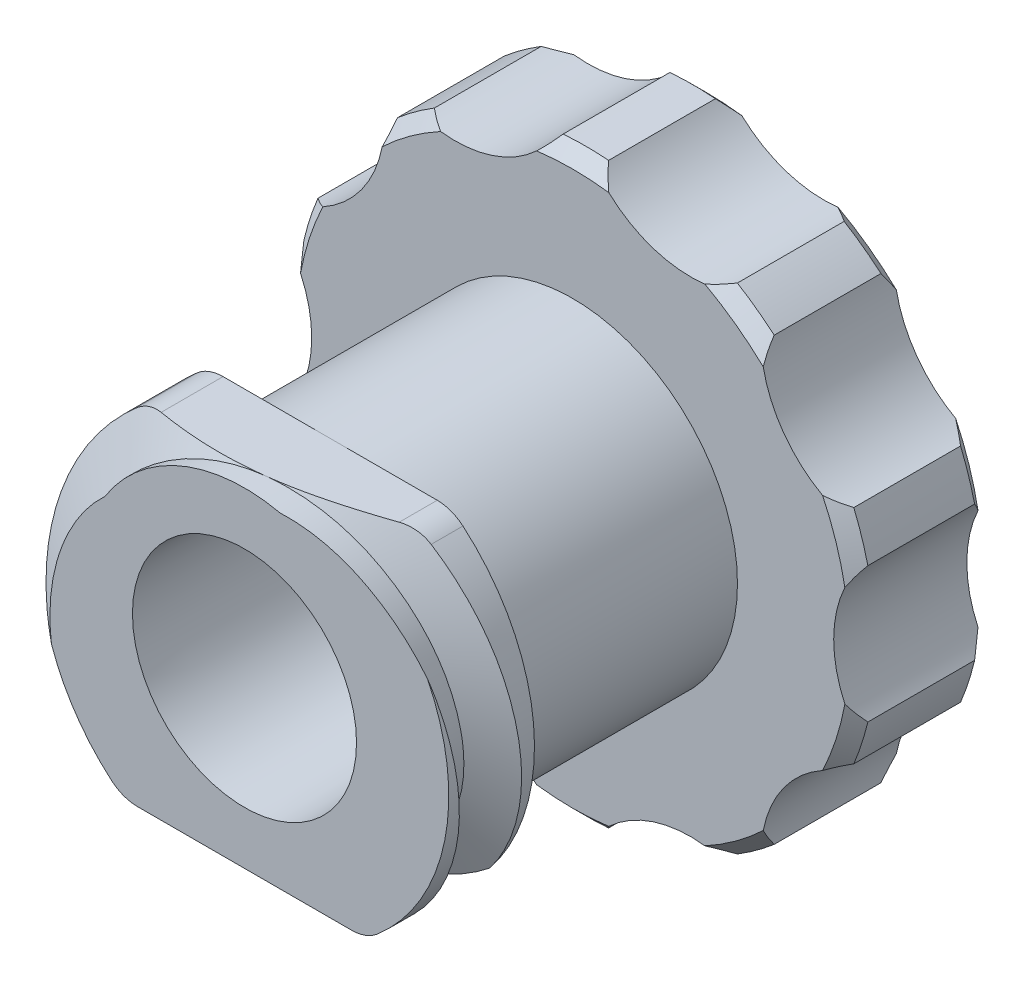
from build123d import *

# Parameters (mm, degrees)
SKETCH20_R          = 3.817056353
BOSS_EXTRUDE1_DEPTH = 1.2827
BOSS_EXTRUDE2_START = -2.5654
BOSS_EXTRUDE2_DEPTH = 2.5654
SKETCH23_R          = 3.175
BOSS_EXTRUDE3_DEPTH = 8.89
SKETCH24_R          = 2.159
CUT_EXTRUDE1_DEPTH  = 8.128
CUT_EXTRUDE1_DRAFT  = -1
SKETCH26_R          = 3.937
SKETCH26_R_2        = 2.159
BOSS_EXTRUDE4_DEPTH = 1.651
CUT_SWEEP1_PITCH    = 2.5
SKETCH29_W          = 15.99045543
SKETCH29_H          = 15.99045543
CUT_EXTRUDE2_DEPTH  = 2.54
SKETCH30_W          = 15.875
SKETCH30_H          = 15.875
CUT_EXTRUDE3_DEPTH  = 2.54
FILLET1_R           = 0.762


with BuildPart() as part:
    # Sketch20 → Boss-Extrude1 (new, symmetric)
    with BuildSketch(Plane.XY):
        with BuildLine():
            ThreePointArc((-2.91972198, 4.764553238), (-1.554108268, 4.783053432), (-0.438429427, 5.570774061))
            ThreePointArc((-0.438429427, 5.570774061), (0, 5.588), (0.438429427, 5.570774061))
            ThreePointArc((0.438429427, 5.570774061), (1.554108268, 4.783053432), (2.91972198, 4.764553238))
            ThreePointArc((2.91972198, 4.764553238), (3.28454399, 4.520786965), (3.629115694, 4.249148536))
            ThreePointArc((3.629115694, 4.249148536), (4.068708268, 2.956089591), (5.162638828, 2.13843502))
            ThreePointArc((5.162638828, 2.13843502), (5.314503813, 1.726786965), (5.433603115, 1.304492693))
            ThreePointArc((5.433603115, 1.304492693), (5.0292, 0), (5.433603115, -1.304492693))
            ThreePointArc((5.433603115, -1.304492693), (5.314503813, -1.726786965), (5.162638828, -2.13843502))
            ThreePointArc((5.162638828, -2.13843502), (4.068708268, -2.956089591), (3.629115694, -4.249148536))
            ThreePointArc((3.629115694, -4.249148536), (3.28454399, -4.520786965), (2.91972198, -4.764553238))
            ThreePointArc((2.91972198, -4.764553238), (1.554108268, -4.783053432), (0.438429427, -5.570774061))
            ThreePointArc((0.438429427, -5.570774061), (0, -5.588), (-0.438429427, -5.570774061))
            ThreePointArc((-0.438429427, -5.570774061), (-1.554108268, -4.783053432), (-2.91972198, -4.764553238))
            ThreePointArc((-2.91972198, -4.764553238), (-3.28454399, -4.520786965), (-3.629115694, -4.249148536))
            ThreePointArc((-3.629115694, -4.249148536), (-4.068708268, -2.956089591), (-5.162638828, -2.13843502))
            ThreePointArc((-5.162638828, -2.13843502), (-5.314503813, -1.726786965), (-5.433603115, -1.304492693))
            ThreePointArc((-5.433603115, -1.304492693), (-5.0292, 0), (-5.433603115, 1.304492693))
            ThreePointArc((-5.433603115, 1.304492693), (-5.314503813, 1.726786965), (-5.162638828, 2.13843502))
            ThreePointArc((-5.162638828, 2.13843502), (-4.068708268, 2.956089591), (-3.629115694, 4.249148536))
            ThreePointArc((-3.629115694, 4.249148536), (-3.28454399, 4.520786965), (-2.91972198, 4.764553238))
        make_face()
        Circle(SKETCH20_R, mode=Mode.SUBTRACT)
    extrude(amount=BOSS_EXTRUDE1_DEPTH, both=True)

    # Sketch21 → Boss-Extrude2 (add)
    with BuildSketch(Plane(origin=(0, 0, -1.2827), x_dir=(-1, 0, 0), z_dir=(0, 0, -1)).offset(BOSS_EXTRUDE2_START)):
        with BuildLine():
            ThreePointArc((3.629115694, 4.249148536), (3.28454399, 4.520786965), (2.91972198, 4.764553238))
            ThreePointArc((2.91972198, 4.764553238), (1.554108268, 4.783053432), (0.438429427, 5.570774061))
            ThreePointArc((0.438429427, 5.570774061), (0, 5.588), (-0.438429427, 5.570774061))
            ThreePointArc((-0.438429427, 5.570774061), (-1.554108268, 4.783053432), (-2.91972198, 4.764553238))
            ThreePointArc((-2.91972198, 4.764553238), (-3.28454399, 4.520786965), (-3.629115694, 4.249148536))
            ThreePointArc((-3.629115694, 4.249148536), (-4.068708268, 2.956089591), (-5.162638828, 2.13843502))
            ThreePointArc((-5.162638828, 2.13843502), (-5.314503813, 1.726786965), (-5.433603115, 1.304492693))
            ThreePointArc((-5.433603115, 1.304492693), (-5.0292, 0), (-5.433603115, -1.304492693))
            ThreePointArc((-5.433603115, -1.304492693), (-5.314503813, -1.726786965), (-5.162638828, -2.13843502))
            ThreePointArc((-5.162638828, -2.13843502), (-4.068708268, -2.956089591), (-3.629115694, -4.249148536))
            ThreePointArc((-3.629115694, -4.249148536), (-3.28454399, -4.520786965), (-2.91972198, -4.764553238))
            ThreePointArc((-2.91972198, -4.764553238), (-1.554108268, -4.783053432), (-0.438429427, -5.570774061))
            ThreePointArc((-0.438429427, -5.570774061), (0, -5.588), (0.438429427, -5.570774061))
            ThreePointArc((0.438429427, -5.570774061), (1.554108268, -4.783053432), (2.91972198, -4.764553238))
            ThreePointArc((2.91972198, -4.764553238), (3.28454399, -4.520786965), (3.629115694, -4.249148536))
            ThreePointArc((3.629115694, -4.249148536), (4.068708268, -2.956089591), (5.162638828, -2.13843502))
            ThreePointArc((5.162638828, -2.13843502), (5.314503813, -1.726786965), (5.433603115, -1.304492693))
            ThreePointArc((5.433603115, -1.304492693), (5.0292, 0), (5.433603115, 1.304492693))
            ThreePointArc((5.433603115, 1.304492693), (5.314503813, 1.726786965), (5.162638828, 2.13843502))
            ThreePointArc((5.162638828, 2.13843502), (4.068708268, 2.956089591), (3.629115694, 4.249148536))
        make_face()
    extrude(amount=BOSS_EXTRUDE2_DEPTH)

    # Sketch23 → Boss-Extrude3 (add)
    with BuildSketch(Plane.XY.offset(-1.2827)):
        Circle(SKETCH23_R)
    extrude(amount=BOSS_EXTRUDE3_DEPTH)


with BuildPart() as cut_extrude1_tool:
    # Sketch24 → Cut-Extrude1 (with draft: the straight prism first)
    with BuildSketch(Plane.XY.offset(7.6073)):
        Circle(SKETCH24_R)
    extrude(amount=-CUT_EXTRUDE1_DEPTH)
    # Cut-Extrude1: the draft: its side faces are tilted about the plane it starts from
    cut_extrude1_sides = [cut_extrude1_tool.faces().sort_by_distance(p)[0] for p in [
        (-2.159, 0, 3.5433),
    ]]
    draft(cut_extrude1_sides, Plane.XY.offset(7.6073), CUT_EXTRUDE1_DRAFT)


with BuildPart() as part_1:
    add(part.part)

    # Cut-Extrude1: cut by cut_extrude1_tool
    add(cut_extrude1_tool.part, mode=Mode.SUBTRACT)

    # Sketch25 → Cut-Revolve1 (revolve, cut)
    with BuildSketch(Plane(origin=(0, 0, 0), x_dir=(0, 0, -1), z_dir=(1, 0, 0))):
        Polygon((1.0287, 5.588), (1.2827, 5.334), (1.2827, 5.588), align=None)
        Polygon((-1.2827, 5.588), (-1.0287, 5.588), (-1.2827, 5.334), align=None)
    revolve(axis=Axis((0, 0, 0), (0, 0, -1)), mode=Mode.SUBTRACT)


with BuildPart() as body_2:
    # Sketch26 → Boss-Extrude4 (new body)
    with BuildSketch(Plane.XY.offset(7.6073)):
        Circle(SKETCH26_R)
        Circle(SKETCH26_R_2, mode=Mode.SUBTRACT)
    extrude(amount=-BOSS_EXTRUDE4_DEPTH)

    # Cut-Sweep1: arcs per turn and ends read off the stored shape
    # Cut-Sweep1: the profile of Sketch28 profile screwed along a right-hand helix through 2.75 turns, 10 arcs to a turn; built about Z, then put on its axis
    cut_sweep1_z = Axis((0, 0, 0), (0, 0, 1))
    cut_sweep1_corners = [(4.699, 0, 0.710652871), (3.1747, 0, -0.000139892), (3.1747, 0, -0.489207237), (4.699, 0, -1.2)]
    with BuildLine(mode=Mode.PRIVATE) as cut_sweep1_profile:
        Line(cut_sweep1_corners[0], cut_sweep1_corners[1])
        Line(cut_sweep1_corners[1], cut_sweep1_corners[2])
        Line(cut_sweep1_corners[2], cut_sweep1_corners[3])
        Line(cut_sweep1_corners[3], cut_sweep1_corners[0])
    cut_sweep1_cap = Face(cut_sweep1_profile.wire())
    cut_sweep1_turn_angles = [0, 18, 36, 54, 72, 90, 108, 126, 144, 162, 180, 198, 216, 234, 252, 270, 288, 306, 324, 342, 360]
    cut_sweep1_turn_weights = [1, 0.9510565162951535, 1, 0.9510565162951535, 1, 0.9510565162951535, 1, 0.9510565162951535, 1, 0.9510565162951535, 1, 0.9510565162951535, 1, 0.9510565162951535, 1, 0.9510565162951535, 1, 0.9510565162951535, 1, 0.9510565162951535, 1]
    cut_sweep1_turn_rails = [Edge.make_bspline([Vector(p[0], p[1], 0).rotate(cut_sweep1_z, cut_sweep1_turn_angles[k]) / cut_sweep1_turn_weights[k] + Vector(0, 0, p[2] + CUT_SWEEP1_PITCH * cut_sweep1_turn_angles[k] / 360) for k in range(21)], [0, 0, 0, 1, 1, 2, 2, 3, 3, 4, 4, 5, 5, 6, 6, 7, 7, 8, 8, 9, 9, 10, 10, 10], 2, cut_sweep1_turn_weights) for p in cut_sweep1_corners]
    cut_sweep1_turn_sides = [Face.make_surface_from_curves(cut_sweep1_turn_rails[p[0]], cut_sweep1_turn_rails[p[1]]) for p in [(0, 1), (1, 2), (2, 3), (3, 0)]]
    cut_sweep1_last_angles = [720, 738, 756, 774, 792, 810, 828, 846, 864, 882, 900, 918, 936, 954, 972, 981, 990]
    cut_sweep1_last_weights = [1, 0.9510565162951535, 1, 0.9510565162951535, 1, 0.9510565162951535, 1, 0.9510565162951535, 1, 0.9510565162951535, 1, 0.9510565162951535, 1, 0.9510565162951535, 1, 0.9876883405951348, 1]
    cut_sweep1_last_rails = [Edge.make_bspline([Vector(p[0], p[1], 0).rotate(cut_sweep1_z, cut_sweep1_last_angles[k]) / cut_sweep1_last_weights[k] + Vector(0, 0, p[2] + CUT_SWEEP1_PITCH * cut_sweep1_last_angles[k] / 360) for k in range(17)], [0, 0, 0, 1, 1, 2, 2, 3, 3, 4, 4, 5, 5, 6, 6, 7, 7, 8, 8, 8], 2, cut_sweep1_last_weights) for p in cut_sweep1_corners]
    cut_sweep1_last_sides = [Face.make_surface_from_curves(cut_sweep1_last_rails[p[0]], cut_sweep1_last_rails[p[1]]) for p in [(0, 1), (1, 2), (2, 3), (3, 0)]]
    cut_sweep1 = Plane(origin=(0, 0, 5.1943), x_dir=(0, 1, 0), z_dir=(0, 0, 1)) * Solid(Shell([*[p.moved(Location((0, 0, CUT_SWEEP1_PITCH * i))) for i in range(2) for p in cut_sweep1_turn_sides], *cut_sweep1_last_sides, cut_sweep1_cap, cut_sweep1_cap.rotate(cut_sweep1_z, 990).moved(Location((0, 0, CUT_SWEEP1_PITCH * 990 / 360)))]))
    add(cut_sweep1, mode=Mode.SUBTRACT)

    # Sketch29 → Cut-Extrude2 (cut)
    with BuildSketch(Plane.XY.offset(7.6073)):
        with Locations((0, -11.170227715)):
            Rectangle(SKETCH29_W, SKETCH29_H)
    extrude(amount=-CUT_EXTRUDE2_DEPTH, mode=Mode.SUBTRACT)

    # Sketch30 → Cut-Extrude3 (cut)
    with BuildSketch(Plane(origin=(0, 0, 5.9563), x_dir=(-1, 0, 0), z_dir=(0, 0, -1))):
        with Locations((0, 11.1125)):
            Rectangle(SKETCH30_W, SKETCH30_H)
    extrude(amount=-CUT_EXTRUDE3_DEPTH, mode=Mode.SUBTRACT)

    # Fillet1
    # the kernel refuses this fillet: 0.762 mm, written as the material it takes off along each edge
    with BuildSketch(Plane(origin=(-2.327948453, -3.175, 5.811773886), x_dir=(1, 0, 0), z_dir=(0, 0, 1))) as fillet1_piece_1:
        with BuildLine():
            CenterArc((0.264442698, 0.762), FILLET1_R, 229.464197889, 40.535802111)
            ThreePointArc((-0.230798683, 0.18288), (-0.117109771, 0.089281399), (0, 0))
            Line((0, 0), (0.264442698, 0))
        make_face()
    extrude(amount=2.53170343, mode=Mode.SUBTRACT)
    with BuildSketch(Plane(origin=(2.327948453, -3.175, 6.315124354), x_dir=(0.7837740920806934, 0.6210460309695931, 0), z_dir=(0, 0, 1))) as fillet1_piece_2:
        with BuildLine():
            CenterArc((0.26597374, 0.761466946), FILLET1_R, 231.607438503, 40.535802111)
            Line((-0.207263336, 0.164231088), (0, 0))
            ThreePointArc((0, 0), (0.147235463, -0.002754111), (0.294470926, 0))
        make_face()
    extrude(amount=2.028352962, mode=Mode.SUBTRACT)
    with BuildSketch(Plane(origin=(2.327948453, 3.175, 5.220122684), x_dir=(-1, 0, 0), z_dir=(0, 0, 1))) as fillet1_piece_3:
        with BuildLine():
            CenterArc((0.264442698, 0.762), FILLET1_R, 229.464197889, 40.535802111)
            ThreePointArc((-0.230798683, 0.18288), (-0.117109771, 0.089281399), (0, 0))
            Line((0, 0), (0.264442698, 0))
        make_face()
    extrude(amount=2.114005833, mode=Mode.SUBTRACT)
    with BuildSketch(Plane(origin=(-2.327948453, 3.175, 5.220122684), x_dir=(-0.7837740920806944, -0.6210460309695918, 0), z_dir=(0, 0, 1))) as fillet1_piece_4:
        with BuildLine():
            CenterArc((0.26597374, 0.761466946), FILLET1_R, 231.607438503, 40.535802111)
            Line((-0.207263336, 0.164231088), (0, 0))
            ThreePointArc((0, 0), (0.147235463, -0.002754111), (0.294470926, 0))
        make_face()
    extrude(amount=2.617356301, mode=Mode.SUBTRACT)


with BuildPart() as part_2:
    add(part_1.part)

    # Combine3: union body 2
    add(body_2.part)


solid = part_2.part
